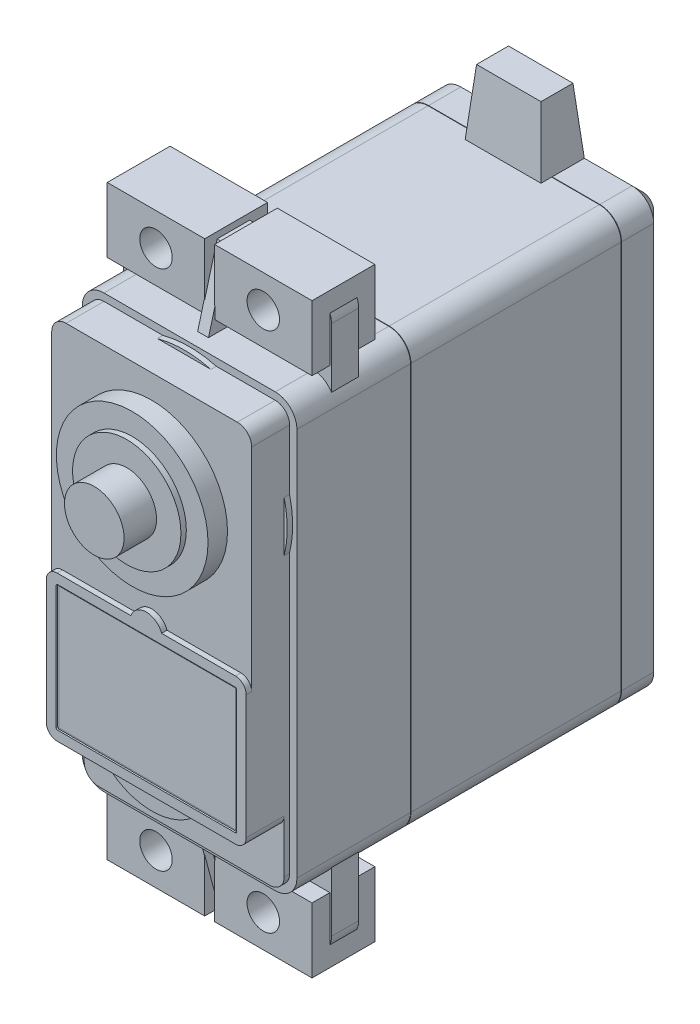
from build123d import *
from OCP.BRepFilletAPI import BRepFilletAPI_MakeChamfer

# Parameters (mm, degrees)
ESTRUSIONE_ESTRUSIONE1_DEPTH  = 4
ESTRUSIONE_ESTRUSIONE2_DEPTH  = 19.44
ESTRUSIONE_ESTRUSIONE3_DEPTH  = 10.5
ESTRUSIONE_ESTRUSIONE4_DEPTH  = 2.5
ESTRUSIONE_ESTRUSIONE5_DEPTH  = 0.5
SMUSSO1_SIZE                  = 1
ESTRUSIONE_ESTRUSIONE6_DEPTH  = 0.5
ESTRUSIONE_ESTRUSIONE7_DEPTH  = 3
ESTRUSIONE_ESTRUSIONE8_DEPTH  = 0.5
SCHIZZO12_R                   = 9.515
ESTRUSIONE_ESTRUSIONE9_DEPTH  = 0.5
TAGLIO_ESTRUSIONE2_DEPTH      = 0.15
SCHIZZO14_R                   = 7
ESTRUSIONE_ESTRUSIONE10_DEPTH = 1.8
SCHIZZO15_R                   = 5
ESTRUSIONE_ESTRUSIONE11_DEPTH = 0.5
SCHIZZO16_R                   = 2.75
TAGLIO_ESTRUSIONE3_DEPTH      = 2
SCHIZZO17_W                   = 16.37936388
SCHIZZO17_H                   = 11.34141705
ESTRUSIONE_ESTRUSIONE12_DEPTH = 0.05
SMUSSO2_SIZE                  = 0.025
SMUSSO2_SIZE2                 = 0.04330127
SMUSSO3_SIZE                  = 0.025
SMUSSO3_SIZE2                 = 0.014433757
SMUSSO4_SIZE                  = 0.025
SMUSSO4_SIZE2                 = 0.014433757
SMUSSO5_SIZE                  = 0.025
SMUSSO5_SIZE2                 = 0.04330127
BOSS_EXTRU_1_DEPTH            = 3
BOSS_EXTRU_1_DEPTH_BACK       = 2
ESQUISSE1_R                   = 2.75
BOSS_EXTRU_2_START            = 1.65
ESQUISSE2_W                   = 9
ESQUISSE2_H                   = 6
ESQUISSE2_R                   = 1.5
BOSS_EXTRU_2_DEPTH            = 5.8
BOSS_EXTRU_2_2_DEPTH          = 5.8
BOSS_EXTRU_2_3_DEPTH          = 5.8
BOSS_EXTRU_2_4_DEPTH          = 5.8
ESQUISSE3_W                   = 7
ESQUISSE3_H                   = 4
BOSS_EXTRU_3_DEPTH            = 6
BOSS_EXTRU_3_TAPER            = 5


with BuildPart() as part:
    # Schizzo2 → Estrusione-Estrusione1 (new body)
    with BuildSketch(Plane.XY):
        with BuildLine():
            Line((7.905, 9.865047966), (-7.905, 9.865047966))
            ThreePointArc((-7.905, 9.865047966), (-9.319213562, 9.279261528), (-9.905, 7.865047966))
            Line((-9.905, 7.865047966), (-9.905, -28.015))
            ThreePointArc((-9.905, -28.015), (-9.319213562, -29.429213562), (-7.905, -30.015))
            Line((-7.905, -30.015), (7.905, -30.015))
            ThreePointArc((7.905, -30.015), (9.319213562, -29.429213562), (9.905, -28.015))
            Line((9.905, -28.015), (9.905, 7.865047966))
            ThreePointArc((9.905, 7.865047966), (9.319213562, 9.279261528), (7.905, 9.865047966))
        make_face()
    extrude(amount=ESTRUSIONE_ESTRUSIONE1_DEPTH)

    # Smusso1
    smusso1_edges = [part.edges().sort_by_distance(p)[0] for p in [
        (-9.905, -10.074976017, 0),
        (-9.319213562, 9.279261528, 0),
        (0, 9.865047966, 0),
        (9.319213562, 9.279261528, 0),
        (9.905, -10.074976017, 0),
        (9.319213562, -29.429213562, 0),
        (0, -30.015, 0),
        (-9.319213562, -29.429213562, 0),
    ]]
    chamfer(smusso1_edges, length=SMUSSO1_SIZE)

    # Smusso2: one chamfer whose edges measure the first distance from different faces: ONE call of the kernel's chamfer builder (chamfer() names one face for all edges)
    smusso2_edges_1 = [part.edges().sort_by_distance(p)[0] for p in [
        (-9.319213562, -29.429213562, 4),
    ]]
    smusso2_side_1 = [part.faces().sort_by_distance(p)[0] for p in [
        (-9.319213562, -29.429213562, 2.5),
    ]]
    smusso2_edges_2 = [part.edges().sort_by_distance(p)[0] for p in [
        (0, -30.015, 4),
    ]]
    smusso2_side_2 = [part.faces().sort_by_distance(p)[0] for p in [
        (0, -30.015, 2.5),
    ]]
    smusso2_edges_3 = [part.edges().sort_by_distance(p)[0] for p in [
        (9.319213562, -29.429213562, 4),
    ]]
    smusso2_side_3 = [part.faces().sort_by_distance(p)[0] for p in [
        (9.319213562, -29.429213562, 2.5),
    ]]
    smusso2_edges_4 = [part.edges().sort_by_distance(p)[0] for p in [
        (9.905, -10.074976017, 4),
    ]]
    smusso2_side_4 = [part.faces().sort_by_distance(p)[0] for p in [
        (9.905, -10.074976017, 2.5),
    ]]
    smusso2_edges_5 = [part.edges().sort_by_distance(p)[0] for p in [
        (9.319213562, 9.279261528, 4),
    ]]
    smusso2_side_5 = [part.faces().sort_by_distance(p)[0] for p in [
        (9.319213562, 9.279261528, 2.5),
    ]]
    smusso2_edges_6 = [part.edges().sort_by_distance(p)[0] for p in [
        (0, 9.865047966, 4),
    ]]
    smusso2_side_6 = [part.faces().sort_by_distance(p)[0] for p in [
        (0, 9.865047966, 2.5),
    ]]
    smusso2_edges_7 = [part.edges().sort_by_distance(p)[0] for p in [
        (-9.319213562, 9.279261528, 4),
    ]]
    smusso2_side_7 = [part.faces().sort_by_distance(p)[0] for p in [
        (-9.319213562, 9.279261528, 2.5),
    ]]
    smusso2_edges_8 = [part.edges().sort_by_distance(p)[0] for p in [
        (-9.905, -10.074976017, 4),
    ]]
    smusso2_side_8 = [part.faces().sort_by_distance(p)[0] for p in [
        (-9.905, -10.074976017, 2.5),
    ]]
    smusso2 = BRepFilletAPI_MakeChamfer(part.part.solid().wrapped)
    for e in smusso2_edges_1:
        smusso2.Add(SMUSSO2_SIZE, SMUSSO2_SIZE2, e.wrapped, smusso2_side_1[0].wrapped)  # the first distance lies on this face
    for e in smusso2_edges_2:
        smusso2.Add(SMUSSO2_SIZE, SMUSSO2_SIZE2, e.wrapped, smusso2_side_2[0].wrapped)  # the first distance lies on this face
    for e in smusso2_edges_3:
        smusso2.Add(SMUSSO2_SIZE, SMUSSO2_SIZE2, e.wrapped, smusso2_side_3[0].wrapped)  # the first distance lies on this face
    for e in smusso2_edges_4:
        smusso2.Add(SMUSSO2_SIZE, SMUSSO2_SIZE2, e.wrapped, smusso2_side_4[0].wrapped)  # the first distance lies on this face
    for e in smusso2_edges_5:
        smusso2.Add(SMUSSO2_SIZE, SMUSSO2_SIZE2, e.wrapped, smusso2_side_5[0].wrapped)  # the first distance lies on this face
    for e in smusso2_edges_6:
        smusso2.Add(SMUSSO2_SIZE, SMUSSO2_SIZE2, e.wrapped, smusso2_side_6[0].wrapped)  # the first distance lies on this face
    for e in smusso2_edges_7:
        smusso2.Add(SMUSSO2_SIZE, SMUSSO2_SIZE2, e.wrapped, smusso2_side_7[0].wrapped)  # the first distance lies on this face
    for e in smusso2_edges_8:
        smusso2.Add(SMUSSO2_SIZE, SMUSSO2_SIZE2, e.wrapped, smusso2_side_8[0].wrapped)  # the first distance lies on this face
    add(Compound.cast(smusso2.Shape()), mode=Mode.REPLACE)



with BuildPart() as body_2:
    # Schizzo3 → Estrusione-Estrusione2 (new body)
    with BuildSketch(Plane.XY.offset(4)):
        with BuildLine():
            Line((-9.905, 7.865047966), (-9.905, -28.015))
            ThreePointArc((-9.905, -28.015), (-9.319213562, -29.429213562), (-7.905, -30.015))
            Line((-7.905, -30.015), (7.905, -30.015))
            ThreePointArc((7.905, -30.015), (9.319213562, -29.429213562), (9.905, -28.015))
            Line((9.905, -28.015), (9.905, 7.865047966))
            ThreePointArc((9.905, 7.865047966), (9.319213562, 9.279261528), (7.905, 9.865047966))
            Line((7.905, 9.865047966), (-7.905, 9.865047966))
            ThreePointArc((-7.905, 9.865047966), (-9.319213562, 9.279261528), (-9.905, 7.865047966))
        make_face()
    extrude(amount=ESTRUSIONE_ESTRUSIONE2_DEPTH)

    # Smusso3
    smusso3_edges = [body_2.edges().sort_by_distance(p)[0] for p in [
        (-9.905, -10.074976017, 4),
        (-9.319213562, 9.279261528, 4),
        (0, 9.865047966, 4),
        (9.319213562, 9.279261528, 4),
        (9.905, -10.074976017, 4),
        (9.319213562, -29.429213562, 4),
        (0, -30.015, 4),
        (-9.319213562, -29.429213562, 4),
    ]]
    smusso3_side = [body_2.faces().sort_by_distance(p)[0] for p in [
        (0, -10.074976017, 4),
    ]]
    chamfer(smusso3_edges, length=SMUSSO3_SIZE, length2=SMUSSO3_SIZE2, reference=smusso3_side[0])

    # Smusso5: one chamfer whose edges measure the first distance from different faces: ONE call of the kernel's chamfer builder (chamfer() names one face for all edges)
    smusso5_edges_1 = [body_2.edges().sort_by_distance(p)[0] for p in [
        (-9.319213562, -29.429213562, 23.44),
    ]]
    smusso5_side_1 = [body_2.faces().sort_by_distance(p)[0] for p in [
        (-9.319213562, -29.429213562, 13.727216878),
    ]]
    smusso5_edges_2 = [body_2.edges().sort_by_distance(p)[0] for p in [
        (0, -30.015, 23.44),
    ]]
    smusso5_side_2 = [body_2.faces().sort_by_distance(p)[0] for p in [
        (0, -30.015, 13.727216878),
    ]]
    smusso5_edges_3 = [body_2.edges().sort_by_distance(p)[0] for p in [
        (9.319213562, -29.429213562, 23.44),
    ]]
    smusso5_side_3 = [body_2.faces().sort_by_distance(p)[0] for p in [
        (9.319213562, -29.429213562, 13.727216878),
    ]]
    smusso5_edges_4 = [body_2.edges().sort_by_distance(p)[0] for p in [
        (9.905, -10.074976017, 23.44),
    ]]
    smusso5_side_4 = [body_2.faces().sort_by_distance(p)[0] for p in [
        (9.905, -10.074976017, 13.727216878),
    ]]
    smusso5_edges_5 = [body_2.edges().sort_by_distance(p)[0] for p in [
        (9.319213562, 9.279261528, 23.44),
    ]]
    smusso5_side_5 = [body_2.faces().sort_by_distance(p)[0] for p in [
        (9.319213562, 9.279261528, 13.727216878),
    ]]
    smusso5_edges_6 = [body_2.edges().sort_by_distance(p)[0] for p in [
        (0, 9.865047966, 23.44),
    ]]
    smusso5_side_6 = [body_2.faces().sort_by_distance(p)[0] for p in [
        (0, 9.865047966, 13.727216878),
    ]]
    smusso5_edges_7 = [body_2.edges().sort_by_distance(p)[0] for p in [
        (-9.319213562, 9.279261528, 23.44),
    ]]
    smusso5_side_7 = [body_2.faces().sort_by_distance(p)[0] for p in [
        (-9.319213562, 9.279261528, 13.727216878),
    ]]
    smusso5_edges_8 = [body_2.edges().sort_by_distance(p)[0] for p in [
        (-9.905, -10.074976017, 23.44),
    ]]
    smusso5_side_8 = [body_2.faces().sort_by_distance(p)[0] for p in [
        (-9.905, -10.074976017, 13.727216878),
    ]]
    smusso5 = BRepFilletAPI_MakeChamfer(body_2.part.solid().wrapped)
    for e in smusso5_edges_1:
        smusso5.Add(SMUSSO5_SIZE, SMUSSO5_SIZE2, e.wrapped, smusso5_side_1[0].wrapped)  # the first distance lies on this face
    for e in smusso5_edges_2:
        smusso5.Add(SMUSSO5_SIZE, SMUSSO5_SIZE2, e.wrapped, smusso5_side_2[0].wrapped)  # the first distance lies on this face
    for e in smusso5_edges_3:
        smusso5.Add(SMUSSO5_SIZE, SMUSSO5_SIZE2, e.wrapped, smusso5_side_3[0].wrapped)  # the first distance lies on this face
    for e in smusso5_edges_4:
        smusso5.Add(SMUSSO5_SIZE, SMUSSO5_SIZE2, e.wrapped, smusso5_side_4[0].wrapped)  # the first distance lies on this face
    for e in smusso5_edges_5:
        smusso5.Add(SMUSSO5_SIZE, SMUSSO5_SIZE2, e.wrapped, smusso5_side_5[0].wrapped)  # the first distance lies on this face
    for e in smusso5_edges_6:
        smusso5.Add(SMUSSO5_SIZE, SMUSSO5_SIZE2, e.wrapped, smusso5_side_6[0].wrapped)  # the first distance lies on this face
    for e in smusso5_edges_7:
        smusso5.Add(SMUSSO5_SIZE, SMUSSO5_SIZE2, e.wrapped, smusso5_side_7[0].wrapped)  # the first distance lies on this face
    for e in smusso5_edges_8:
        smusso5.Add(SMUSSO5_SIZE, SMUSSO5_SIZE2, e.wrapped, smusso5_side_8[0].wrapped)  # the first distance lies on this face
    add(Compound.cast(smusso5.Shape()), mode=Mode.REPLACE)


with BuildPart() as body_3:
    # Schizzo4 → Estrusione-Estrusione3 (new body)
    with BuildSketch(Plane.XY.offset(23.44)):
        with BuildLine():
            Line((-9.905, 7.865047966), (-9.905, -28.015))
            ThreePointArc((-9.905, -28.015), (-9.319213562, -29.429213562), (-7.905, -30.015))
            Line((-7.905, -30.015), (7.905, -30.015))
            ThreePointArc((7.905, -30.015), (9.319213562, -29.429213562), (9.905, -28.015))
            Line((9.905, -28.015), (9.905, 7.865047966))
            ThreePointArc((9.905, 7.865047966), (9.319213562, 9.279261528), (7.905, 9.865047966))
            Line((7.905, 9.865047966), (-7.905, 9.865047966))
            ThreePointArc((-7.905, 9.865047966), (-9.319213562, 9.279261528), (-9.905, 7.865047966))
        make_face()
    extrude(amount=ESTRUSIONE_ESTRUSIONE3_DEPTH)


with BuildPart() as body_4:
    # Schizzo5 → Estrusione-Estrusione4 (new body)
    with BuildSketch(Plane.XY.offset(27.94)):
        with BuildLine():
            Line((-9.605, 14.415), (-9.605, 8.918613341))
            ThreePointArc((-9.605, 8.918613341), (-8.877848716, 9.612493351), (-7.905, 9.865047966))
            Line((-7.905, 9.865047966), (7.905, 9.865047966))
            ThreePointArc((7.905, 9.865047966), (8.877848716, 9.612493351), (9.605, 8.918613341))
            Line((9.605, 8.918613341), (9.605, 14.415))
            ThreePointArc((9.605, 14.415), (9.019213562, 15.829213562), (7.605, 16.415))
            Line((7.605, 16.415), (6.353, 16.415))
            Line((6.353, 16.415), (6.353, 15.761391495))
            ThreePointArc((6.353, 15.761391495), (4.953, 11.75), (3.553, 15.761391495))
            Line((3.553, 15.761391495), (3.553, 16.415))
            Line((3.553, 16.415), (-3.553, 16.415))
            Line((-3.553, 16.415), (-3.553, 15.761391495))
            ThreePointArc((-3.553, 15.761391495), (-4.953, 11.75), (-6.353, 15.761391495))
            Line((-6.353, 15.761391495), (-6.353, 16.415))
            Line((-6.353, 16.415), (-7.605, 16.415))
            ThreePointArc((-7.605, 16.415), (-9.019213562, 15.829213562), (-9.605, 14.415))
        make_face()
    extrude(amount=ESTRUSIONE_ESTRUSIONE4_DEPTH)


with BuildPart() as body_5:
    # Schizzo7 → Estrusione-Estrusione5 (new, symmetric)
    with BuildSketch(Plane(origin=(0, 0, 0), x_dir=(0, 0, -1), z_dir=(1, 0, 0))):
        Polygon((-30.44, 16.415), (-30.94, 16.415), (-32.695054358, 9.865047966), (-30.44, 9.865047966), align=None)
    extrude(amount=ESTRUSIONE_ESTRUSIONE5_DEPTH, both=True)


with BuildPart() as body_6:
    # Specchia1: mirrored copy
    add(body_4.part.mirror(Plane.ZX.offset(-10.074976017)))


with BuildPart() as body_7:
    # Specchia1 2: mirrored copy
    add(body_5.part.mirror(Plane.ZX.offset(-10.074976017)))

    # Abbina1: union body 6, body 3, body 4, body 5
    add(body_6.part)
    add(body_3.part)
    add(body_4.part)
    add(body_5.part)

    # Schizzo9 → Estrusione-Estrusione6 (add)
    with BuildSketch(Plane.XY.offset(33.94)):
        with BuildLine():
            Line((-9.228699641, 7.865047966), (-9.228699641, -28.015))
            ThreePointArc((-9.228699641, -28.015), (-8.840996992, -28.950996992), (-7.905, -29.338699641))
            Line((-7.905, -29.338699641), (7.905, -29.338699641))
            ThreePointArc((7.905, -29.338699641), (8.840996992, -28.950996992), (9.228699641, -28.015))
            Line((9.228699641, -28.015), (9.228699641, 7.865047966))
            ThreePointArc((9.228699641, 7.865047966), (8.840996992, 8.801044958), (7.905, 9.188747607))
            Line((7.905, 9.188747607), (-7.905, 9.188747607))
            ThreePointArc((-7.905, 9.188747607), (-8.840996992, 8.801044958), (-9.228699641, 7.865047966))
        make_face()
    extrude(amount=ESTRUSIONE_ESTRUSIONE6_DEPTH)

    # Schizzo10 → Estrusione-Estrusione7 (add)
    with BuildSketch(Plane.XY.offset(34.44)):
        with BuildLine():
            ThreePointArc((-9.228699641, -23.131004117), (-8.935806422, -23.838110898), (-8.228699641, -24.131004117))
            Line((-8.228699641, -24.131004117), (-4.195714176, -24.131004117))
            ThreePointArc((-4.195714176, -24.131004117), (0.010982299, -25.852721195), (4.217678774, -24.131004117))
            Line((4.217678774, -24.131004117), (8.228699641, -24.131004117))
            ThreePointArc((8.228699641, -24.131004117), (8.935806422, -23.838110898), (9.228699641, -23.131004117))
            Line((9.228699641, -23.131004117), (9.228699641, 7.865047966))
            ThreePointArc((9.228699641, 7.865047966), (8.840996992, 8.801044958), (7.905, 9.188747607))
            Line((7.905, 9.188747607), (-7.905, 9.188747607))
            ThreePointArc((-7.905, 9.188747607), (-8.840996992, 8.801044958), (-9.228699641, 7.865047966))
            Line((-9.228699641, 7.865047966), (-9.228699641, -23.131004117))
        make_face()
    extrude(amount=ESTRUSIONE_ESTRUSIONE7_DEPTH)

    # Schizzo11 → Estrusione-Estrusione8 (add)
    with BuildSketch(Plane.XY.offset(37.44)):
        with BuildLine():
            ThreePointArc((-9.228699641, -23.131004117), (-8.935806422, -23.838110898), (-8.228699641, -24.131004117))
            Line((-8.228699641, -24.131004117), (-4.195714176, -24.131004117))
            Line((-4.195714176, -24.131004117), (4.217678774, -24.131004117))
            Line((4.217678774, -24.131004117), (8.228699641, -24.131004117))
            ThreePointArc((8.228699641, -24.131004117), (8.935806422, -23.838110898), (9.228699641, -23.131004117))
            Line((9.228699641, -23.131004117), (9.228699641, -11.689587067))
            ThreePointArc((9.228699641, -11.689587067), (8.935806422, -10.982480286), (8.228699641, -10.689587067))
            Line((8.228699641, -10.689587067), (1.414213562, -10.689587067))
            ThreePointArc((1.414213562, -10.689587067), (0, -9.689587067), (-1.414213562, -10.689587067))
            Line((-1.414213562, -10.689587067), (-8.228699641, -10.689587067))
            ThreePointArc((-8.228699641, -10.689587067), (-8.935806422, -10.982480286), (-9.228699641, -11.689587067))
            Line((-9.228699641, -11.689587067), (-9.228699641, -23.131004117))
        make_face()
    extrude(amount=ESTRUSIONE_ESTRUSIONE8_DEPTH)

    # Schizzo12 → Estrusione-Estrusione9 (add)
    with BuildSketch(Plane.XY.offset(33.94)):
        Circle(SCHIZZO12_R)
    extrude(amount=ESTRUSIONE_ESTRUSIONE9_DEPTH)

    # Schizzo13 → Taglio-Estrusione2 (cut)
    with BuildSketch(Plane.XY.offset(37.94)):
        with BuildLine():
            Line((8.350664239, -23.081004117), (8.350664239, -11.739587067))
            ThreePointArc((8.350664239, -11.739587067), (8.306730256, -11.63352105), (8.200664239, -11.589587067))
            Line((8.200664239, -11.589587067), (-8.178699641, -11.589587067))
            ThreePointArc((-8.178699641, -11.589587067), (-8.284765658, -11.63352105), (-8.328699641, -11.739587067))
            Line((-8.328699641, -11.739587067), (-8.328699641, -23.081004117))
            ThreePointArc((-8.328699641, -23.081004117), (-8.284765658, -23.187070134), (-8.178699641, -23.231004117))
            Line((-8.178699641, -23.231004117), (8.200664239, -23.231004117))
            ThreePointArc((8.200664239, -23.231004117), (8.306730256, -23.187070134), (8.350664239, -23.081004117))
        make_face()
    extrude(amount=-TAGLIO_ESTRUSIONE2_DEPTH, mode=Mode.SUBTRACT)

    # Schizzo14 → Estrusione-Estrusione10 (add)
    with BuildSketch(Plane.XY.offset(37.44)):
        Circle(SCHIZZO14_R)
    extrude(amount=ESTRUSIONE_ESTRUSIONE10_DEPTH)

    # Schizzo15 → Estrusione-Estrusione11 (add)
    with BuildSketch(Plane.XY.offset(39.24)):
        Circle(SCHIZZO15_R)
    extrude(amount=ESTRUSIONE_ESTRUSIONE11_DEPTH)

    # Schizzo16 → Taglio-Estrusione3 (cut)
    with BuildSketch(Plane.XY.offset(39.74)):
        Circle(SCHIZZO16_R)
    extrude(amount=-TAGLIO_ESTRUSIONE3_DEPTH, mode=Mode.SUBTRACT)

    # Smusso4
    smusso4_edges = [body_7.edges().sort_by_distance(p)[0] for p in [
        (0, -30.015, 23.44),
        (0, 9.865047966, 23.44),
        (-9.319213562, 9.279261528, 23.44),
        (-9.905, -10.074976017, 23.44),
        (-9.319213562, -29.429213562, 23.44),
        (9.319213562, -29.429213562, 23.44),
        (9.905, -10.074976017, 23.44),
        (9.319213562, 9.279261528, 23.44),
    ]]
    smusso4_side = [body_7.faces().sort_by_distance(p)[0] for p in [
        (0, -10.074976017, 23.44),
    ]]
    chamfer(smusso4_edges, length=SMUSSO4_SIZE, length2=SMUSSO4_SIZE2, reference=smusso4_side[0])

    # Esquisse1 → Boss.-Extru.1 (add, two sides: drawn at the far end of the back side and taken through both)
    with BuildSketch(Plane.XY.offset(39.74).offset(-BOSS_EXTRU_1_DEPTH_BACK)):
        Circle(ESQUISSE1_R)
    extrude(amount=BOSS_EXTRU_1_DEPTH + BOSS_EXTRU_1_DEPTH_BACK)


with BuildPart() as body_4_2:
    # Schizzo17 → Estrusione-Estrusione12 (new body)
    with BuildSketch(Plane.XY.offset(37.79)):
        with Locations((0.010982299, -17.410295592)):
            Rectangle(SCHIZZO17_W, SCHIZZO17_H)
    extrude(amount=ESTRUSIONE_ESTRUSIONE12_DEPTH)


with BuildPart() as body_5_2:
    # Esquisse2 → Boss.-Extru.2 (new body)
    with BuildSketch(Plane.XY.offset(30.44).offset(BOSS_EXTRU_2_START)):
        with Locations((-4.953, -34.149952034)):
            Rectangle(ESQUISSE2_W, ESQUISSE2_H)
        with Locations((-4.953, -34.149952034)):
            Circle(ESQUISSE2_R, mode=Mode.SUBTRACT)
    extrude(amount=-BOSS_EXTRU_2_DEPTH)


with BuildPart() as body_6_2:
    # Esquisse2 → Boss.-Extru.2 2 (new body)
    with BuildSketch(Plane.XY.offset(30.44).offset(BOSS_EXTRU_2_START)):
        with Locations((-4.953, 14)):
            Rectangle(ESQUISSE2_W, ESQUISSE2_H)
        with Locations(Location((-4.953, 14, 0), (0, 0, 180))):
            Circle(ESQUISSE2_R, mode=Mode.SUBTRACT)
    extrude(amount=-BOSS_EXTRU_2_2_DEPTH)


with BuildPart() as body_7_2:
    # Esquisse2 → Boss.-Extru.2 3 (new body)
    with BuildSketch(Plane.XY.offset(30.44).offset(BOSS_EXTRU_2_START)):
        with Locations((4.953, -34.149952034)):
            Rectangle(ESQUISSE2_W, ESQUISSE2_H)
        with Locations(Location((4.953, -34.149952034, 0), (0, 0, 180))):
            Circle(ESQUISSE2_R, mode=Mode.SUBTRACT)
    extrude(amount=-BOSS_EXTRU_2_3_DEPTH)


with BuildPart() as body_8:
    # Esquisse2 → Boss.-Extru.2 4 (new body)
    with BuildSketch(Plane.XY.offset(30.44).offset(BOSS_EXTRU_2_START)):
        with Locations((4.953, 14)):
            Rectangle(ESQUISSE2_W, ESQUISSE2_H)
        with Locations((4.953, 14)):
            Circle(ESQUISSE2_R, mode=Mode.SUBTRACT)
    extrude(amount=-BOSS_EXTRU_2_4_DEPTH)


with BuildPart() as part_1:
    add(part.part)

    add(body_2.part)  # Boss.-Extru.3 merges body 2
    # Esquisse3 → Boss.-Extru.3 (add)
    with BuildSketch(Plane(origin=(0, 9.865047966, 0), x_dir=(1, 0, 0), z_dir=(0, 1, 0))):
        with Locations((0, -3)):
            Rectangle(ESQUISSE3_W, ESQUISSE3_H)
    extrude(amount=BOSS_EXTRU_3_DEPTH, taper=BOSS_EXTRU_3_TAPER)


solid = Compound([body_7.part, body_4_2.part, body_5_2.part, body_6_2.part, body_7_2.part, body_8.part, part_1.part])
